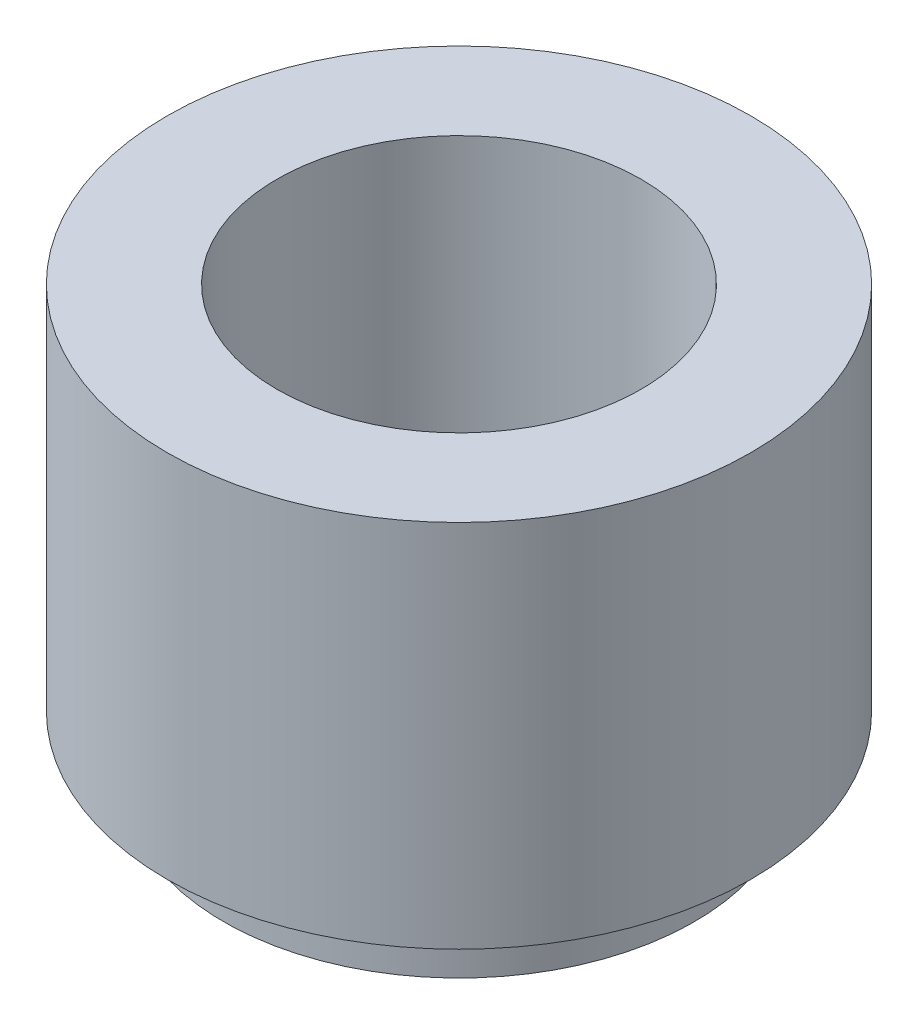
from build123d import *

# Parameters (mm, degrees)
SKETCH1_R                    = 9.525
BOSS_EXTRUDE1_DEPTH          = 5.715
BOSS_EXTRUDE2_DEPTH          = 6.35
SKETCH3_R                    = 7.9375
BOSS_EXTRUDE3_DEPTH          = 1.058333333
SKETCH4_R                    = 7.6835
BOSS_EXTRUDE4_DEPTH          = 1.058333333
F_1_4_18_NPSM_TAPPED_HOLE2_D = 11.8872
SKETCH11_R                   = 10.998522628
SKETCH11_R_2                 = 9.525
CUT_EXTRUDE1_DEPTH           = 21.317795019


with BuildPart() as part:
    # Sketch1 → Boss-Extrude1 (new body)
    with BuildSketch(Plane(origin=(0, 0, 0), x_dir=(1, 0, 0), z_dir=(0, 1, 0))):
        Circle(SKETCH1_R)
    extrude(amount=BOSS_EXTRUDE1_DEPTH)

    # Sketch2 → Boss-Extrude2 (add)
    with BuildSketch(Plane.XZ):
        Polygon((0, -10.998522628), (9.525, -5.499261314), (9.525, 5.499261314), (0, 10.998522628), (-9.525, 5.499261314), (-9.525, -5.499261314), align=None)
    extrude(amount=BOSS_EXTRUDE2_DEPTH)

    # Sketch3 → Boss-Extrude3 (add)
    with BuildSketch(Plane.XZ.offset(6.35)):
        Circle(SKETCH3_R)
    extrude(amount=BOSS_EXTRUDE3_DEPTH)

    # Sketch4 → Boss-Extrude4 (add)
    with BuildSketch(Plane.XZ.offset(7.408333333)):
        Circle(SKETCH4_R)
    extrude(amount=BOSS_EXTRUDE4_DEPTH)

    # 1/4-18 NPSM Tapped Hole2 (through all)
    with Locations(Plane(origin=(0, 5.715, 0), x_dir=(1, 0, 0), z_dir=(0, 1, 0))):
        with Locations((0, 0)):
            Hole(F_1_4_18_NPSM_TAPPED_HOLE2_D / 2)

    # Sketch11 → Cut-Extrude1 (cut, through all)
    with BuildSketch(Plane(origin=(0, 5.715, 0), x_dir=(1, 0, 0), z_dir=(0, 1, 0))):
        Circle(SKETCH11_R)
        Circle(SKETCH11_R_2, mode=Mode.SUBTRACT)
    extrude(amount=-CUT_EXTRUDE1_DEPTH, mode=Mode.SUBTRACT)


solid = part.part
